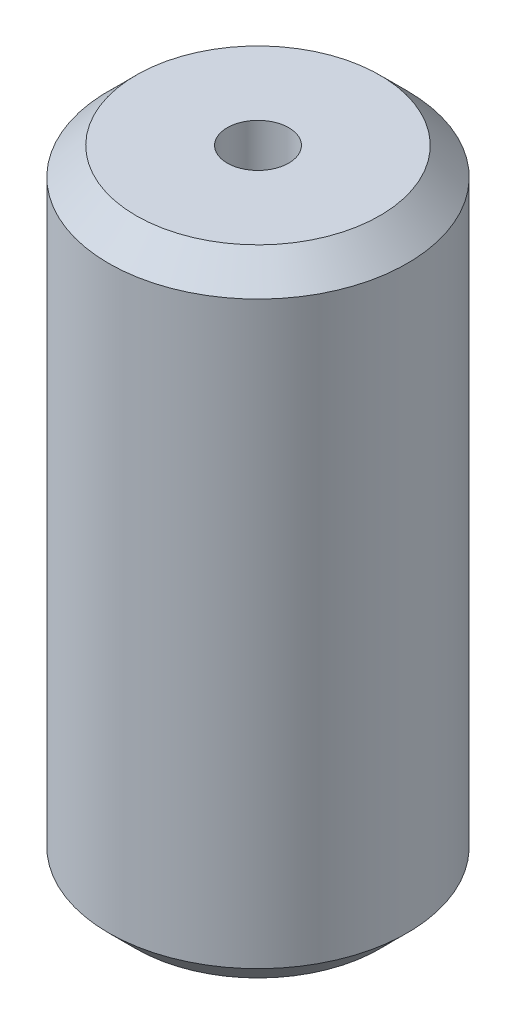
from build123d import *

# Parameters (mm, degrees)
SKETCH1_R           = 5
BOSS_EXTRUDE1_DEPTH = 21.25662395
SKETCH2_R           = 1.029142794
CUT_EXTRUDE1_DEPTH  = 23.4018763
CHAMFER1_SIZE       = 0.921339232


with BuildPart() as part:
    # Sketch1 → Boss-Extrude1 (new body)
    with BuildSketch(Plane(origin=(0, 0, 0), x_dir=(1, 0, 0), z_dir=(0, 1, 0))):
        Circle(SKETCH1_R)
    extrude(amount=BOSS_EXTRUDE1_DEPTH)

    # Sketch2 → Cut-Extrude1 (cut, through all)
    with BuildSketch(Plane(origin=(0, 0, 0), x_dir=(1, 0, 0), z_dir=(0, 1, 0))):
        Circle(SKETCH2_R)
    extrude(amount=CUT_EXTRUDE1_DEPTH, mode=Mode.SUBTRACT)

    # Chamfer1
    chamfer1_edges = [part.edges().sort_by_distance(p)[0] for p in [
        (-5, 21.25662395, 0),
        (-5, 0, 0),
    ]]
    chamfer(chamfer1_edges, length=CHAMFER1_SIZE)


solid = part.part
